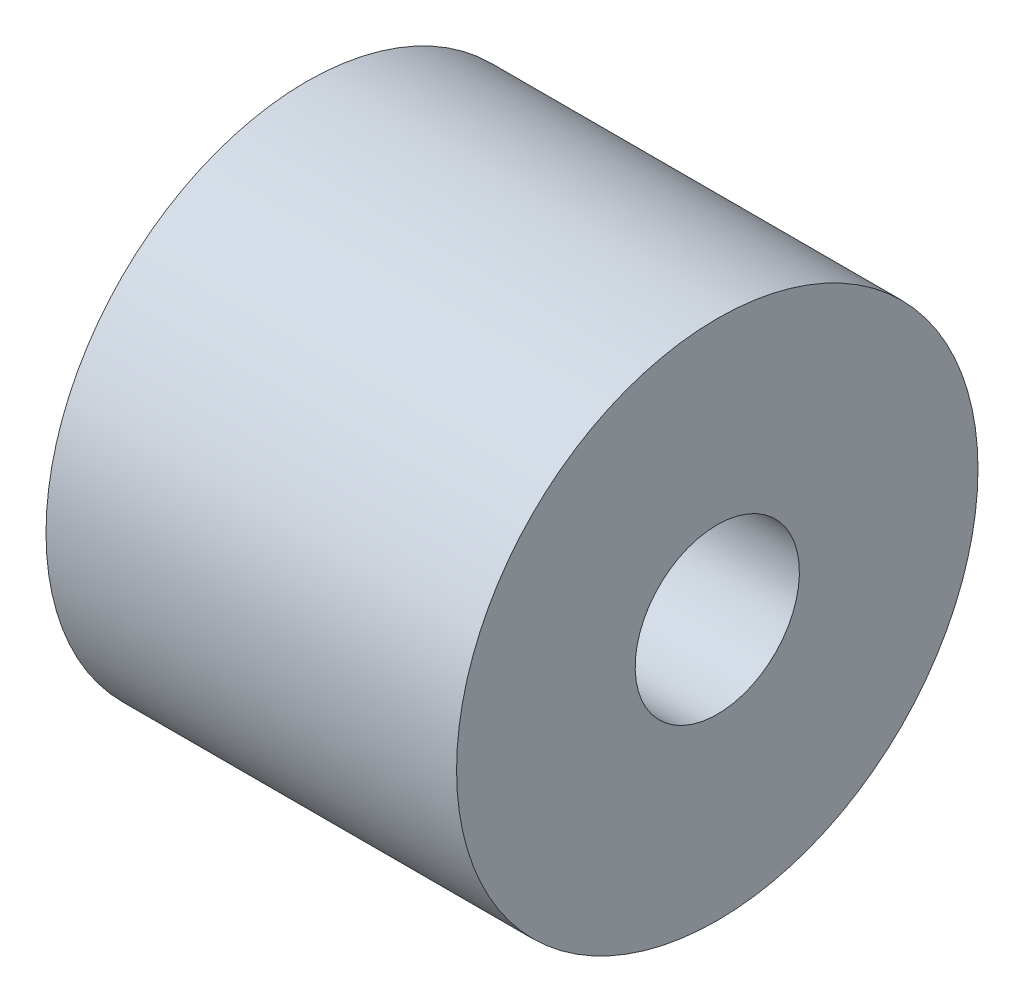
from build123d import *

# Parameters (mm, degrees)
ESQUISSE1_R        = 6.35
ESQUISSE1_R_2      = 2
BOSS_EXTRU_1_DEPTH = 10


with BuildPart() as part:
    # Esquisse1 → Boss.-Extru.1 (new body)
    with BuildSketch(Plane(origin=(-130.403171357, 0, 0), x_dir=(0, 0, -1), z_dir=(1, 0, 0))):
        with Locations((-120.908236412, 39.009623756)):
            Circle(ESQUISSE1_R)
        with Locations((-120.908236412, 39.009623756)):
            Circle(ESQUISSE1_R_2, mode=Mode.SUBTRACT)
    extrude(amount=-BOSS_EXTRU_1_DEPTH)


solid = part.part
